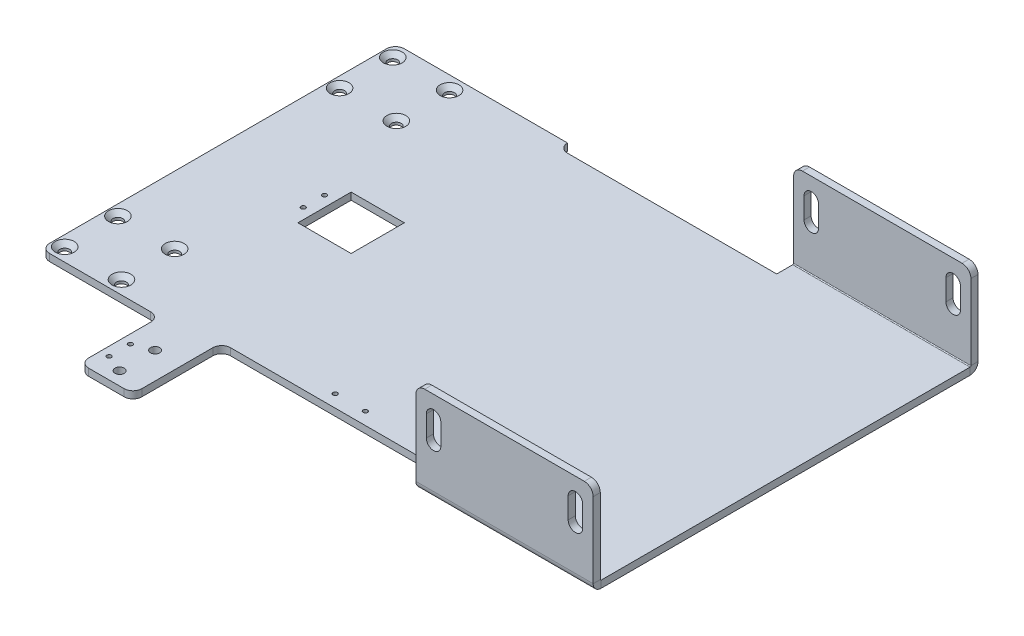
from build123d import *

# Parameters (mm, degrees)
SKETCH_1_W                  = 320
SKETCH_1_H                  = 200
SM_BASE_FLANGE_1_DEPTH      = 4
HOLE_WIZARD_1_AT_2_COUNT    = 2
HOLE_WIZARD_1_AT_2_PITCH    = 30
HOLE_WIZARD_1_AT_3_COUNT    = 2
HOLE_WIZARD_1_AT_3_PITCH    = 43.863424399
HOLE_WIZARD_1_AT_4_COUNT    = 2
HOLE_WIZARD_1_AT_4_PITCH    = 32
HOLE_WIZARD_1_AT_5_COUNT    = 2
HOLE_WIZARD_1_AT_5_PITCH    = 129.031004026
HOLE_WIZARD_1_AT_6_COUNT    = 2
HOLE_WIZARD_1_AT_6_PITCH    = 125
HOLE_WIZARD_1_AT_7_COUNT    = 2
HOLE_WIZARD_1_AT_7_PITCH    = 158.268758762
HOLE_WIZARD_1_AT_8_COUNT    = 2
HOLE_WIZARD_1_AT_8_PITCH    = 155
SKETCH_9_W                  = 30
SKETCH_9_H                  = 45
SM_BASE_FLANGE_1_2_DEPTH    = 4
SKETCH_27_W                 = 123
SKETCH_27_H                 = 5
CUT_EXTRUDE_2_DEPTH         = 10
SM_EDGE_FLANGE_1_DEPTH      = 100
SM_EDGE_FLANGE_1_BEND_DEPTH = 100
HOLE_START                  = -108.5
HOLE_WIZARD_8_2_8_2_1_DEPTH = 217
F_5_2_5_2_DIAMETER_HOLE1_D  = 5.2
CUT_EXTRUDE_1_REACH         = 223.199
SKETCH_21_W                 = 30
SKETCH_21_H                 = 30
HOLE_WIZARD_M3_2_D          = 2.5
OTHER_START                 = -108.5
OTHER_1_DEPTH               = 217
OTHER_START_2               = -4
OTHER_2_DEPTH               = 4
OTHER_2_2_DEPTH             = 4
HOLE_WIZARD_M3_1_D          = 2.5
HOLE_WIZARD_M3_3_D          = 2.5


# Read off the part's stored shape, not the designer's step: Ø8.2 (8.2) 直径槽口1, 断开-边角1, 断开-边角2
# Sheet-metal steps are written as plain solids
with BuildPart() as part:
    # Sketch 1 → Sm Base Flange 1 (new body)
    with BuildSketch(Plane(origin=(0, 0, 0), x_dir=(1, 0, 0), z_dir=(0, 1, 0))):
        Rectangle(SKETCH_1_W, SKETCH_1_H)
    extrude(amount=-SM_BASE_FLANGE_1_DEPTH)

    # 草图7 → 打孔尺寸开槽半沉头螺钉的类型1 (revolve, cut)
    with BuildSketch(Plane(origin=(-154, 0, 62.5), x_dir=(0, 0, 1), z_dir=(1, 0, 0))):
        Polygon((0, 0), (0, 4), (2.75, 4), (2.75, 2.55), (5.3, 0), align=None)
    hole_wizard_1 = revolve(axis=Axis((-154, 6.35, 62.5), (0, -1, 0)), mode=Mode.SUBTRACT)

    # 打孔尺寸开槽半沉头螺钉的类型1 at 2: 打孔尺寸开槽半沉头螺钉的类型1 ×2
    with Locations(*[(0, 0, i * HOLE_WIZARD_1_AT_2_PITCH) for i in range(1, HOLE_WIZARD_1_AT_2_COUNT)]):
        add(hole_wizard_1, mode=Mode.SUBTRACT)

    # 打孔尺寸开槽半沉头螺钉的类型1 at 3: 打孔尺寸开槽半沉头螺钉的类型1 ×2
    with Locations(*[Vector(0.7295372041400852, 0, 0.6839411288813297) * (i * HOLE_WIZARD_1_AT_3_PITCH) for i in range(1, HOLE_WIZARD_1_AT_3_COUNT)]):
        add(hole_wizard_1, mode=Mode.SUBTRACT)

    # 打孔尺寸开槽半沉头螺钉的类型1 at 4: 打孔尺寸开槽半沉头螺钉的类型1 ×2
    with Locations(*[(i * HOLE_WIZARD_1_AT_4_PITCH, 0, 0) for i in range(1, HOLE_WIZARD_1_AT_4_COUNT)]):
        add(hole_wizard_1, mode=Mode.SUBTRACT)

    # 打孔尺寸开槽半沉头螺钉的类型1 at 5: 打孔尺寸开槽半沉头螺钉的类型1 ×2
    with Locations(*[Vector(0.24800241028513723, 0, -0.9687594151763185) * (i * HOLE_WIZARD_1_AT_5_PITCH) for i in range(1, HOLE_WIZARD_1_AT_5_COUNT)]):
        add(hole_wizard_1, mode=Mode.SUBTRACT)

    # 打孔尺寸开槽半沉头螺钉的类型1 at 6: 打孔尺寸开槽半沉头螺钉的类型1 ×2
    with Locations(*[(0, 0, -i * HOLE_WIZARD_1_AT_6_PITCH) for i in range(1, HOLE_WIZARD_1_AT_6_COUNT)]):
        add(hole_wizard_1, mode=Mode.SUBTRACT)

    # 打孔尺寸开槽半沉头螺钉的类型1 at 7: 打孔尺寸开槽半沉头螺钉的类型1 ×2
    with Locations(*[Vector(0.20218772327747656, 0, -0.979346784625278) * (i * HOLE_WIZARD_1_AT_7_PITCH) for i in range(1, HOLE_WIZARD_1_AT_7_COUNT)]):
        add(hole_wizard_1, mode=Mode.SUBTRACT)

    # 打孔尺寸开槽半沉头螺钉的类型1 at 8: 打孔尺寸开槽半沉头螺钉的类型1 ×2
    with Locations(*[(0, 0, -i * HOLE_WIZARD_1_AT_8_PITCH) for i in range(1, HOLE_WIZARD_1_AT_8_COUNT)]):
        add(hole_wizard_1, mode=Mode.SUBTRACT)

    # 草图9 → Sm Base Flange 1 2 (add)
    with BuildSketch(Plane(origin=(0, 0, 0), x_dir=(1, 0, 0), z_dir=(0, 1, 0))):
        with Locations((-78, -122.5)):
            Rectangle(SKETCH_9_W, SKETCH_9_H)
    extrude(amount=-SM_BASE_FLANGE_1_2_DEPTH)

    # 草图27 → 切除-拉伸2 (cut)
    with BuildSketch(Plane(origin=(0, 0, 0), x_dir=(1, 0, 0), z_dir=(0, 1, 0))):
        with Locations((-1.5, -97.5)):
            Rectangle(SKETCH_27_W, SKETCH_27_H)
        with Locations((-1.5, 97.5)):
            Rectangle(SKETCH_27_W, SKETCH_27_H)
    extrude(amount=-CUT_EXTRUDE_2_DEPTH, mode=Mode.SUBTRACT)

    # 边线-法兰1 section (across the edge) → 边线-法兰1 (add)
    with BuildSketch(Plane(origin=(60, 0, 104.5), x_dir=(0, 0, -1), z_dir=(1, 0, 0))):
        with BuildLine():
            Line((-4, 0.5), (-4, 48))
            Line((-4, 48), (0, 48))
            Line((0, 48), (0, 0.5))
            ThreePointArc((0, 0.5), (0.146446609, 0.146446609), (0.5, 0))
            Line((0.5, 0), (4.5, 0))
            Line((4.5, 0), (4.5, -4))
            Line((4.5, -4), (0.5, -4))
            ThreePointArc((0.5, -4), (-2.681980515, -2.681980515), (-4, 0.5))
        make_face()
    extrude(amount=SM_EDGE_FLANGE_1_DEPTH)

    # 边线-法兰1 section 2 (across the edge) → 边线-法兰1 bend (add)
    with BuildSketch(Plane(origin=(160, 0, -104.5), x_dir=(0, 0, 1), z_dir=(-1, 0, 0))):
        with BuildLine():
            Line((-4, 0.5), (-4, 48))
            Line((-4, 48), (0, 48))
            Line((0, 48), (0, 0.5))
            ThreePointArc((0, 0.5), (0.146446609, 0.146446609), (0.5, 0))
            Line((0.5, 0), (4.5, 0))
            Line((4.5, 0), (4.5, -4))
            Line((4.5, -4), (0.5, -4))
            ThreePointArc((0.5, -4), (-2.681980515, -2.681980515), (-4, 0.5))
        make_face()
    extrude(amount=SM_EDGE_FLANGE_1_BEND_DEPTH)

    # Ø8.2 (8.2) 直径槽口1 outline → Ø8.2 (8.2) 直径槽口1 (cut)
    with BuildSketch(Plane.XY.offset(HOLE_START)):
        with BuildLine():
            ThreePointArc((145.9, 24.6), (150, 20.5), (154.1, 24.6))
            Line((154.1, 24.6), (154.1, 36.4))
            ThreePointArc((154.1, 36.4), (150, 40.5), (145.9, 36.4))
            Line((145.9, 36.4), (145.9, 24.6))
        make_face()
        with BuildLine():
            ThreePointArc((65.9, 24.6), (70, 20.5), (74.1, 24.6))
            Line((74.1, 24.6), (74.1, 36.4))
            ThreePointArc((74.1, 36.4), (70, 40.5), (65.9, 36.4))
            Line((65.9, 36.4), (65.9, 24.6))
        make_face()
    extrude(amount=HOLE_WIZARD_8_2_8_2_1_DEPTH, mode=Mode.SUBTRACT)

    # Ø5.2 (5.2) Diameter Hole1 (through all)
    with Locations(Plane(origin=(0, 0, 0), x_dir=(1, 0, 0), z_dir=(0, 1, 0))):
        with Locations((-78, -137.5), (-78, -117.5)):
            Hole(F_5_2_5_2_DIAMETER_HOLE1_D / 2)

    # 草图21 → 切除-拉伸1 (cut, up to next)
    with BuildSketch(Plane(origin=(0, 0, 0), x_dir=(1, 0, 0), z_dir=(0, 1, 0)), mode=Mode.PRIVATE) as cut_extrude_1_sk1:
        with Locations((-85, 0)):
            Rectangle(SKETCH_21_W, SKETCH_21_H)
    cut_extrude_1_tool1 = extrude(cut_extrude_1_sk1.sketch, amount=-CUT_EXTRUDE_1_REACH, mode=Mode.PRIVATE) & part.part
    add(cut_extrude_1_tool1.solids().sort_by_distance((-85, 0, 0))[0], mode=Mode.SUBTRACT)

    # M3 螺纹孔2 (through all)
    with Locations(Plane(origin=(0, 0, 0), x_dir=(1, 0, 0), z_dir=(0, 1, 0))):
        with Locations((-106, 6), (-106, -6)):
            Hole(HOLE_WIZARD_M3_2_D / 2)

    # Other 1 outline → Other 1 (cut)
    with BuildSketch(Plane.XY.offset(OTHER_START)):
        with BuildLine():
            ThreePointArc((60, 43), (61.464466094, 46.535533906), (65, 48))
            Line((65, 48), (60, 48))
            Line((60, 48), (60, 43))
        make_face()
        with BuildLine():
            ThreePointArc((155, 48), (158.535533906, 46.535533906), (160, 43))
            Line((160, 43), (160, 48))
            Line((160, 48), (155, 48))
        make_face()
    extrude(amount=OTHER_1_DEPTH, mode=Mode.SUBTRACT)

    # Other 2 outline → Other 2 (cut)
    with BuildSketch(Plane(origin=(0, 0, 0), x_dir=(1, 0, 0), z_dir=(0, 1, 0)).offset(OTHER_START_2)):
        with BuildLine():
            ThreePointArc((-63, -140), (-64.464466094, -143.535533906), (-68, -145))
            Line((-68, -145), (-63, -145))
            Line((-63, -145), (-63, -140))
        make_face()
        with BuildLine():
            ThreePointArc((-88, -145), (-91.535533906, -143.535533906), (-93, -140))
            Line((-93, -140), (-93, -145))
            Line((-93, -145), (-88, -145))
        make_face()
        with BuildLine():
            ThreePointArc((-155, -100), (-158.535533906, -98.535533906), (-160, -95))
            Line((-160, -95), (-160, -100))
            Line((-160, -100), (-155, -100))
        make_face()
        with BuildLine():
            ThreePointArc((-160, 95), (-158.535533906, 98.535533906), (-155, 100))
            Line((-155, 100), (-160, 100))
            Line((-160, 100), (-160, 95))
        make_face()
    extrude(amount=OTHER_2_DEPTH, mode=Mode.SUBTRACT)

    # Other 2 2 outline → Other 2 2 (add)
    with BuildSketch(Plane(origin=(0, 0, 0), x_dir=(1, 0, 0), z_dir=(0, 1, 0)).offset(OTHER_START_2)):
        with BuildLine():
            ThreePointArc((-58, 95), (-61.535533906, 96.464466094), (-63, 100))
            Line((-63, 100), (-63, 95))
            Line((-63, 95), (-58, 95))
        make_face()
        with BuildLine():
            Line((-63, -95), (-63, -100))
            ThreePointArc((-63, -100), (-61.535533906, -96.464466094), (-58, -95))
            Line((-58, -95), (-63, -95))
        make_face()
        with BuildLine():
            Line((-93, -100), (-98, -100))
            ThreePointArc((-98, -100), (-94.464466094, -101.464466094), (-93, -105))
            Line((-93, -105), (-93, -100))
        make_face()
    extrude(amount=OTHER_2_2_DEPTH)

    # M3 螺纹孔1 (through all)
    with Locations(Plane(origin=(0, 0, 0), x_dir=(1, 0, 0), z_dir=(0, 1, 0))):
        with Locations((-6, -88), (11, -88)):
            Hole(HOLE_WIZARD_M3_1_D / 2)

    # M3 螺纹孔3 (through all)
    with Locations(Plane(origin=(0, 0, 0), x_dir=(1, 0, 0), z_dir=(0, 1, 0))):
        with Locations((-88, -121.5), (-88, -133.5)):
            Hole(HOLE_WIZARD_M3_3_D / 2)


solid = part.part
